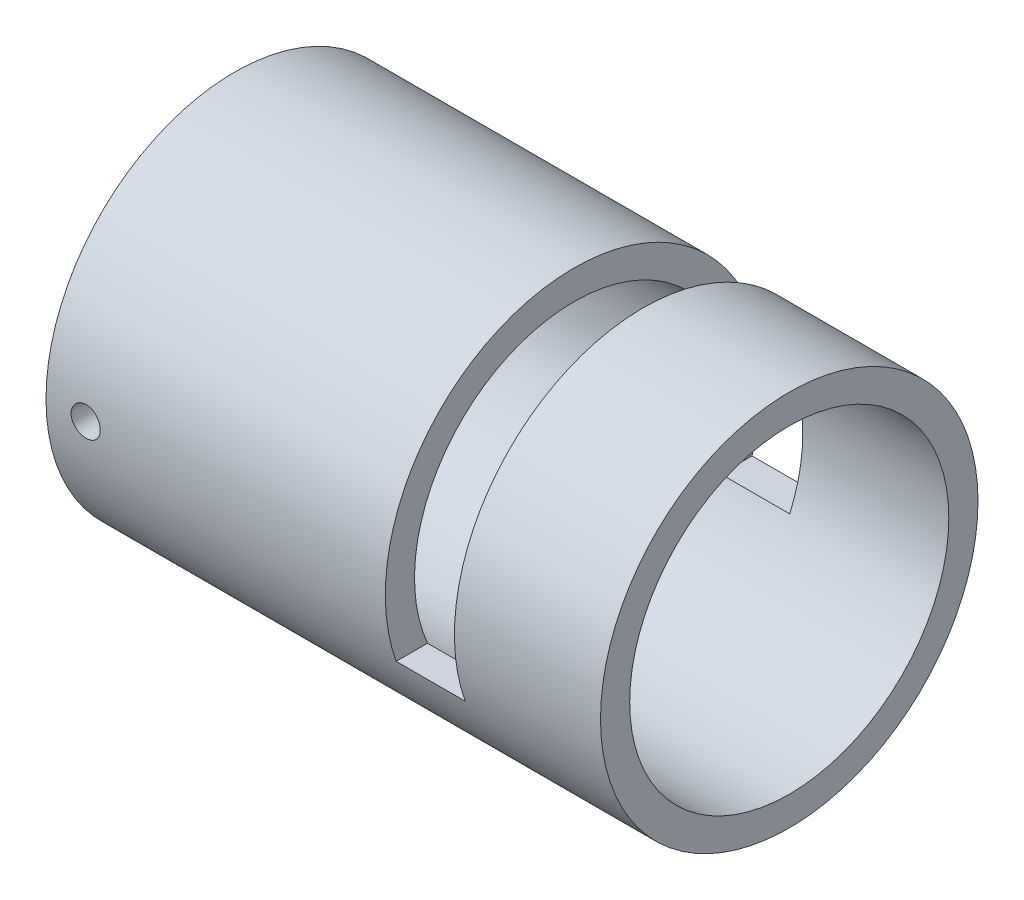
from build123d import *

# Parameters (mm, degrees)
SKETCH1_R               = 25.869040911
SKETCH1_R_2             = 21.869040911
BOSS_EXTRUDE1_DEPTH     = 76
SKETCH2_W               = 9.472494485
SKETCH2_H               = 40.402624636
CUT_EXTRUDE1_DEPTH      = 73.5
CUT_EXTRUDE2_REACH      = 97.509
CUT_EXTRUDE2_END_RADIUS = 21.869040911
SKETCH3_R               = 2
MIRROR1_START           = 21.777395316
MIRROR1_OUTLINE_R       = 2
MIRROR1_DEPTH           = 4.091645695


# Read off the part's stored shape, not the designer's step: Mirror1
with BuildPart() as part:
    # Sketch1 → Boss-Extrude1 (new body)
    with BuildSketch(Plane(origin=(0, 0, 0), x_dir=(0, 0, -1), z_dir=(1, 0, 0))):
        Circle(SKETCH1_R)
        Circle(SKETCH1_R_2, mode=Mode.SUBTRACT)
    extrude(amount=-BOSS_EXTRUDE1_DEPTH)

    # Sketch2 → Cut-Extrude1 (cut, symmetric)
    with BuildSketch(Plane.XY):
        with Locations((-24.754490459, 11.562535947)):
            Rectangle(SKETCH2_W, SKETCH2_H)
    extrude(amount=CUT_EXTRUDE1_DEPTH, both=True, mode=Mode.SUBTRACT)

    # Cut-Extrude2: up to this cylinder (the profile starts outside it)
    cut_extrude2_end = Plane(origin=(-70.565521, 0, 0), z_dir=(1, 0, 0)) * Cylinder(CUT_EXTRUDE2_END_RADIUS, 239.756081822, mode=Mode.PRIVATE)
    # Sketch3 → Cut-Extrude2 (cut, up to the surface)
    with BuildSketch(Plane(origin=(0, 0, -25.869040911), x_dir=(-1, 0, 0), z_dir=(0, 0, -1)), mode=Mode.PRIVATE) as cut_extrude2_sk1:
        with Locations((70.565520642, 0)):
            Circle(SKETCH3_R)
    cut_extrude2_tool1 = extrude(cut_extrude2_sk1.sketch, amount=-CUT_EXTRUDE2_REACH, mode=Mode.PRIVATE) - cut_extrude2_end
    add(cut_extrude2_tool1.solids().sort_by_distance((-70.565521, 0, -25.869041))[0], mode=Mode.SUBTRACT)

    # Mirror1 outline → Mirror1 (cut)
    with BuildSketch(Plane.XY.offset(MIRROR1_START)):
        with Locations((-70.565520642, 0)):
            Circle(MIRROR1_OUTLINE_R)
    extrude(amount=MIRROR1_DEPTH, mode=Mode.SUBTRACT)


solid = part.part
